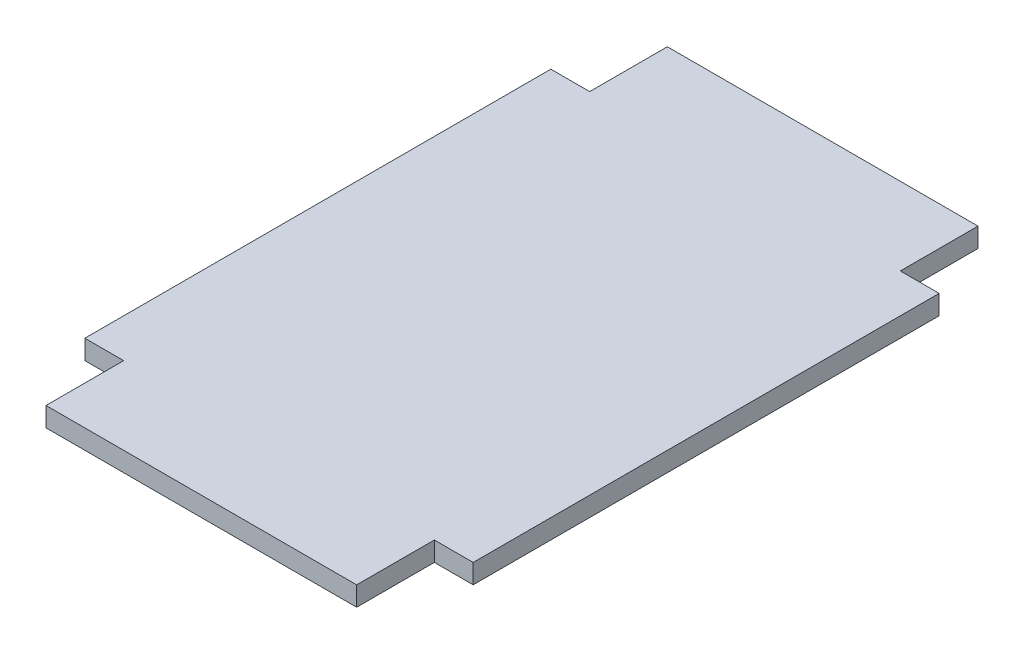
from build123d import *

# Parameters (mm, degrees)
BOSS_EXTRUDE1_DEPTH = 19.05


with BuildPart() as part:
    # Sketch1 → Boss-Extrude1 (new body)
    with BuildSketch(Plane(origin=(0, 0, 0), x_dir=(1, 0, 0), z_dir=(0, 1, 0))):
        Polygon((-194.750523985, 337.116103092), (-194.750523985, -120.083896908), (-156.650523985, -120.083896908), (-156.650523985, -196.283896908), (148.149476015, -196.283896908), (148.149476015, -120.083896908), (186.249476015, -120.083896908), (186.249476015, 337.116103092), (148.149476015, 337.116103092), (148.149476015, 413.316103092), (-156.650523985, 413.316103092), (-156.650523985, 337.116103092), align=None)
    extrude(amount=BOSS_EXTRUDE1_DEPTH)


solid = part.part
